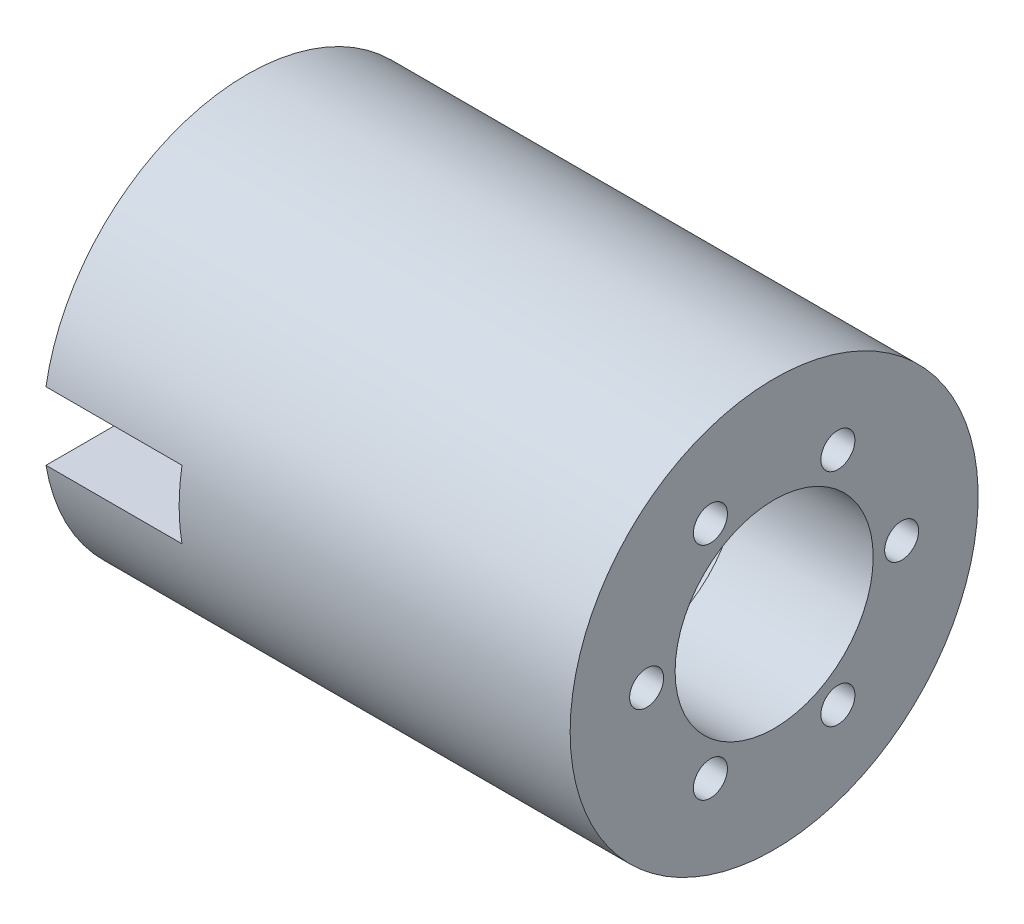
from build123d import *

# Parameters (mm, degrees)
SKETCH2_R          = 18.5
SKETCH2_R_2        = 3.175
CUT_EXTRUDE1_DEPTH = 25.4
CIRPATTERN1_COUNT  = 6
SKETCH3_W          = 25.4
SKETCH3_H          = 12.7
CUT_EXTRUDE2_DEPTH = 73.973215334


with BuildPart() as part:
    # Sketch1 → Revolve1 (revolve)
    with BuildSketch(Plane.XY):
        Polygon((-49.2125, 38.1), (-49.2125, 21.2725), (23.8125, 21.2725), (23.8125, 15.875), (49.2125, 15.875), (49.2125, 38.1), align=None)
    revolve(axis=Axis((-49.2125, 0, 0), (1, 0, 0)))

    # Sketch2 → Cut-Extrude1 (cut)
    with BuildSketch(Plane(origin=(49.2125, 0, 0), x_dir=(0, 0, -1), z_dir=(1, 0, 0))):
        Circle(SKETCH2_R)
        with Locations((-11.90625, 20.622229928)):
            Circle(SKETCH2_R_2)
        with Locations((11.90625, 20.622229928)):
            Circle(SKETCH2_R_2)
        with Locations((23.8125, 0)):
            Circle(SKETCH2_R_2)
        with Locations((11.90625, -20.622229928)):
            Circle(SKETCH2_R_2)
        with Locations((-11.90625, -20.622229928)):
            Circle(SKETCH2_R_2)
    cut_extrude1 = extrude(amount=-CUT_EXTRUDE1_DEPTH, mode=Mode.SUBTRACT)

    # CirPattern1: Cut-Extrude1 ×6 about axis
    cirpattern1_axis = Axis((-49.2125, 0, 0), (-1, 0, 0))
    for i in range(1, CIRPATTERN1_COUNT):
        add(cut_extrude1.rotate(cirpattern1_axis, i * 360 / CIRPATTERN1_COUNT), mode=Mode.SUBTRACT)

    # Sketch3 → Cut-Extrude2 (cut, through all)
    with BuildSketch(Plane.XY):
        with Locations((-36.5125, 0)):
            Rectangle(SKETCH3_W, SKETCH3_H)
    extrude(amount=CUT_EXTRUDE2_DEPTH, mode=Mode.SUBTRACT)


solid = part.part
